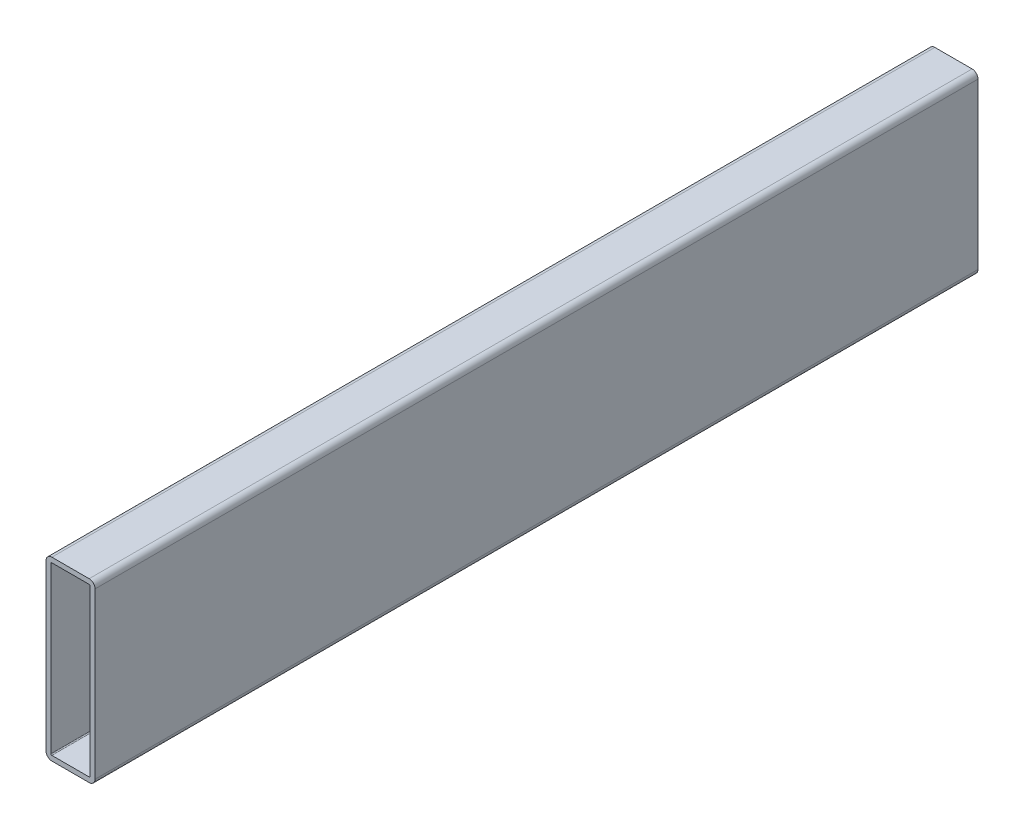
from build123d import *

# Parameters (mm, degrees)
BOSS_EXTRUDE1_DEPTH = 450


with BuildPart() as part:
    # Sketch1 → Boss-Extrude1 (new, symmetric)
    with BuildSketch(Plane.XY):
        with BuildLine():
            Line((19, -90), (-19, -90))
            ThreePointArc((-19, -90), (-23.242640687, -88.242640687), (-25, -84))
            Line((-25, -84), (-25, 84))
            ThreePointArc((-25, 84), (-23.242640687, 88.242640687), (-19, 90))
            Line((-19, 90), (19, 90))
            ThreePointArc((19, 90), (23.242640687, 88.242640687), (25, 84))
            Line((25, 84), (25, -84))
            ThreePointArc((25, -84), (23.242640687, -88.242640687), (19, -90))
        make_face()
        with BuildLine():
            Line((19, 85), (-19, 85))
            ThreePointArc((-19, 85), (-19.707106781, 84.707106781), (-20, 84))
            Line((-20, 84), (-20, -84))
            ThreePointArc((-20, -84), (-19.707106781, -84.707106781), (-19, -85))
            Line((-19, -85), (19, -85))
            ThreePointArc((19, -85), (19.707106781, -84.707106781), (20, -84))
            Line((20, -84), (20, 84))
            ThreePointArc((20, 84), (19.707106781, 84.707106781), (19, 85))
        make_face(mode=Mode.SUBTRACT)
    extrude(amount=BOSS_EXTRUDE1_DEPTH, both=True)


solid = part.part
